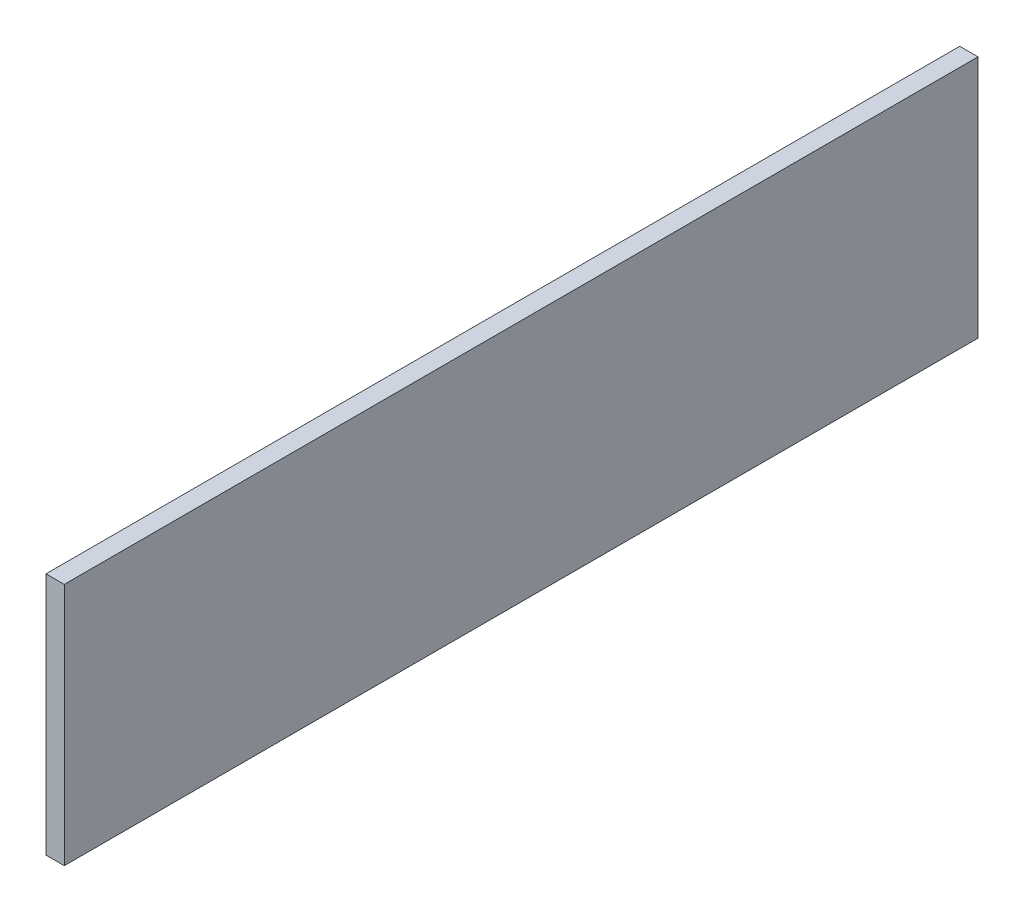
from build123d import *

# Parameters (mm, degrees)
SKETCH1_W           = 1500
SKETCH1_H           = 400
BOSS_EXTRUDE1_DEPTH = 30


with BuildPart() as part:
    # Sketch1 → Boss-Extrude1 (new body)
    with BuildSketch(Plane(origin=(0, 0, 0), x_dir=(0, 0, -1), z_dir=(1, 0, 0))):
        with Locations((-101.851851852, 218.055555556)):
            Rectangle(SKETCH1_W, SKETCH1_H)
    extrude(amount=BOSS_EXTRUDE1_DEPTH)


solid = part.part
